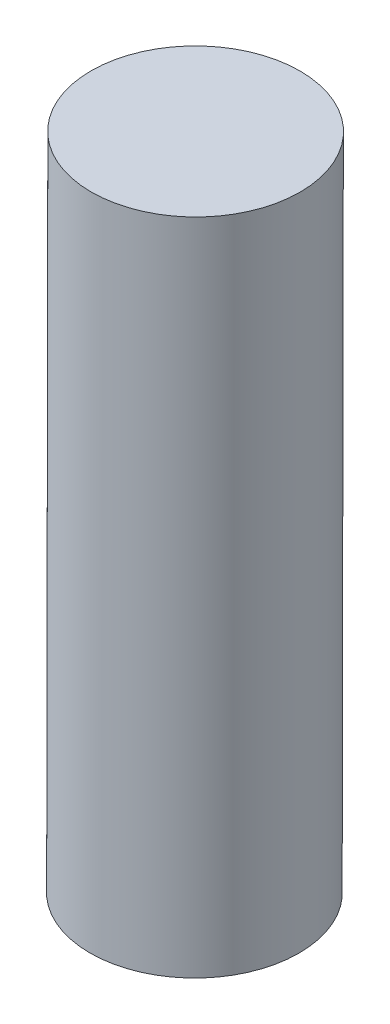
from build123d import *

# Parameters (mm, degrees)
SWEEP1_PROFILE_R = 4.699


with BuildPart() as part:
    # Sweep1: sweep along a curve in space
    with BuildLine() as sweep1_path:
        Line((-266.617064338, 133.219904817, 163.321796793), (-266.564789386, 162.850522993, 163.321797194))
    # Sweep1 profile (on start of the path) → Sweep1 (sweep)
    with BuildSketch(Plane(origin=(-266.617064338, 133.219904817, 163.321796793), x_dir=(0.9999984437661837, -0.0017642180168527322, 0), z_dir=(0.001764218016852732, 0.9999984437661835, 1.3540190170962705e-08))):
        Circle(SWEEP1_PROFILE_R)
    sweep(path=sweep1_path.line)


solid = part.part
